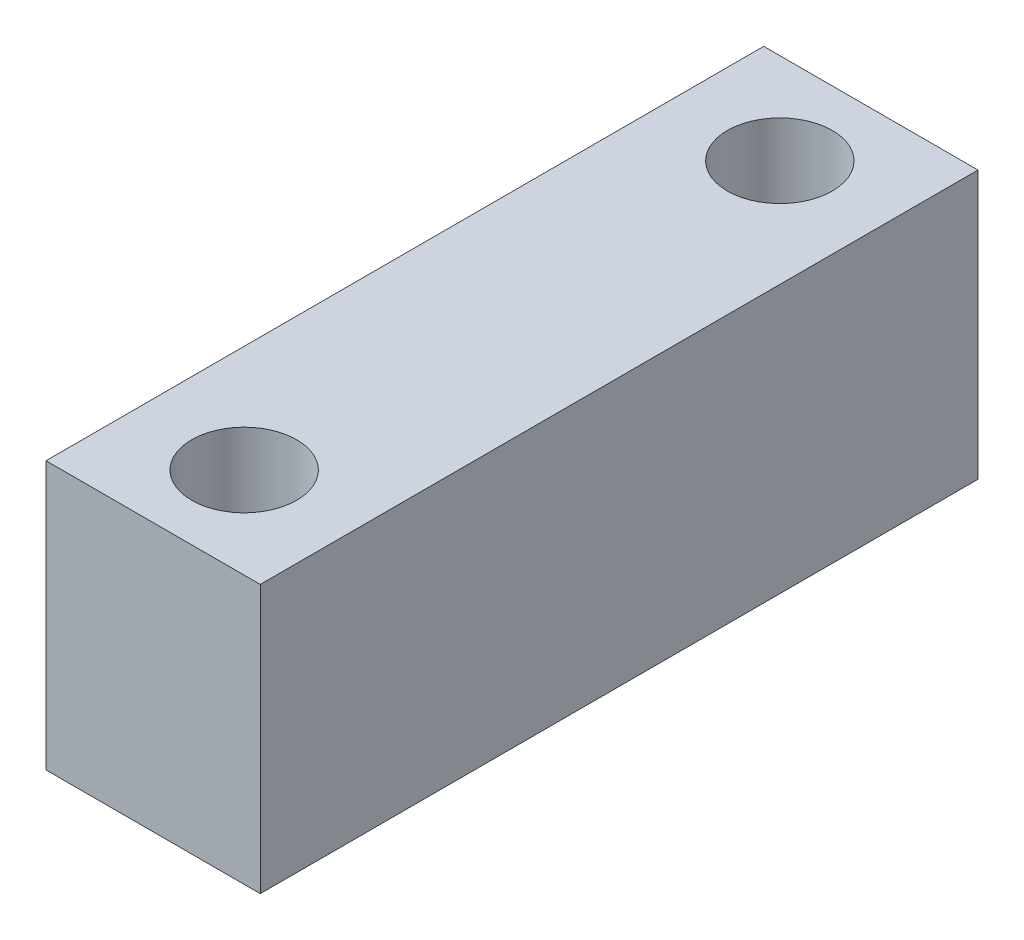
from build123d import *

# Parameters (mm, degrees)
SKETCH4_W              = 10.16
SKETCH4_H              = 34.036
BOSS_EXTRUDE1_DEPTH    = 12.7
F_10_CLEARANCE_HOLE1_D = 4.9784


with BuildPart() as part:
    # Sketch4 → Boss-Extrude1 (new body)
    with BuildSketch(Plane(origin=(0, 0, 0), x_dir=(1, 0, 0), z_dir=(0, 1, 0))):
        with Locations((-61.333792588, 6.232898137)):
            Rectangle(SKETCH4_W, SKETCH4_H)
    extrude(amount=BOSS_EXTRUDE1_DEPTH)

    # #10 Clearance Hole1 (through all)
    with Locations(Plane(origin=(0, 12.7, 0), x_dir=(1, 0, 0), z_dir=(0, 1, 0))):
        with Locations((-61.333792588, 18.932898137), (-61.333792588, -6.467101863)):
            Hole(F_10_CLEARANCE_HOLE1_D / 2)


solid = part.part
